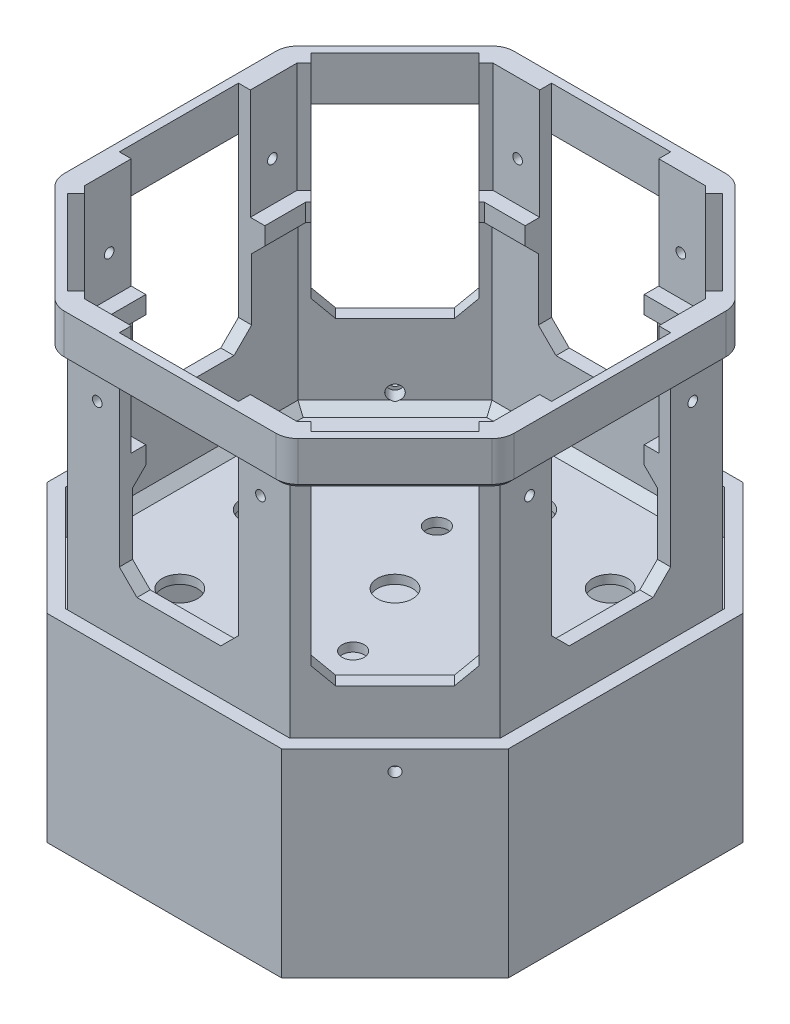
from build123d import *

# Parameters (mm, degrees)
EXTRUDE_1_DEPTH                      = 70
SKETCH_2_W                           = 27
SKETCH_2_H                           = 3
CUT_EXTRUDE_1_DEPTH                  = 50
CHAMFER_4_SIZE                       = 4
PATTERN_CIRCULAR_1_COUNT             = 4
CHAMFER_4_OF_PATTERN_CIRCULAR_1_SIZE = 4
EXTRUDE_2_DEPTH                      = 2
CHAMFER_2_SIZE                       = 2
EXTRUDE_3_DEPTH                      = 10
FILLET_1_R                           = 5
CHAMFER_3_SIZE                       = 1
SKETCH_8_R                           = 4
CUT_EXTRUDE_3_DEPTH                  = 100.126182212
SKETCH_9_R                           = 2.5
CUT_EXTRUDE_4_DEPTH                  = 100.126182212
EXTRUDE_START                        = -25
EXTRUDE_5_DEPTH                      = 4
PATTERN_CIRCULAR_16_COUNT            = 4
CHAMFER_6_SIZE                       = 3
EXTRUDE_6_DEPTH                      = 10
EXTRUDE_8_DEPTH                      = 3
EXTRUDE_9_DEPTH                      = 30
EXTRUDE_10_DEPTH                     = 2
FILLET_2_R                           = 8
CHAMFER_8_SIZE                       = 7
SKETCH_16_W                          = 10
SKETCH_16_H                          = 20
CUT_EXTRUDE_5_DEPTH                  = 30
CHAMFER_7_SIZE                       = 3
SKETCH_17_R                          = 1.65
CUT_EXTRUDE_6_DEPTH                  = 30
SKETCH_18_R                          = 1.15
CUT_EXTRUDE_7_DEPTH                  = 3
PATTERN_CIRCULAR_17_COUNT            = 4
PATTERN_CIRCULAR_18_COUNT            = 4
SKETCH_21_R                          = 1.1
CUT_EXTRUDE_8_DEPTH                  = 6
PATTERN_CIRCULAR_19_COUNT            = 4
CUT_EXTRUDE_9_REACH                  = 130.435


with BuildPart() as part:
    # 草图1 → 凸台-拉伸1 (new body)
    with BuildSketch(Plane(origin=(0, 0, 0), x_dir=(1, 0, 0), z_dir=(0, 1, 0))):
        Polygon((-25.246212025, -49), (25.246212025, -49), (49, -25.246212025), (49, 25.246212025), (25.246212025, 49), (-25.246212025, 49), (-49, 25.246212025), (-49, -25.246212025), align=None)
        Polygon((24.003571337, 46), (-24.003571337, 46), (-46, 24.003571337), (-46, -24.003571337), (-24.003571337, -46), (24.003571337, -46), (46, -24.003571337), (46, 24.003571337), align=None, mode=Mode.SUBTRACT)
    extrude(amount=EXTRUDE_1_DEPTH)

    # 草图2 → 切除-拉伸1 (cut)
    with BuildSketch(Plane(origin=(0, 70, 0), x_dir=(1, 0, 0), z_dir=(0, 1, 0))):
        with Locations((0, -47.5)):
            Rectangle(SKETCH_2_W, SKETCH_2_H)
        Polygon((27.577164466, -46.669047558), (25.455844123, -44.547727215), (44.547727215, -25.455844123), (46.669047558, -27.577164466), align=None)
    cut_extrude_1 = extrude(amount=-CUT_EXTRUDE_1_DEPTH, mode=Mode.SUBTRACT)

    # 倒角4
    chamfer_4_edges = [part.edges().sort_by_distance(p)[0] for p in [
        (13.5, 20, 47.5),
        (-13.5, 20, 47.5),
        (26.516504294, 20, 45.608387387),
        (45.608387387, 20, 26.516504294),
    ]]
    chamfer(chamfer_4_edges, length=CHAMFER_4_SIZE)

    # 阵列(圆周)1: 切除-拉伸1 ×4 about axis
    pattern_circular_1_axis = Axis((0, 0, 0), (0, 1, 0))
    for i in range(1, PATTERN_CIRCULAR_1_COUNT):
        add(cut_extrude_1.rotate(pattern_circular_1_axis, i * 360 / PATTERN_CIRCULAR_1_COUNT), mode=Mode.SUBTRACT)

    # 倒角4 of 阵列(圆周)1
    chamfer_4_of_pattern_circular_1_edges = [part.edges().sort_by_distance(p)[0] for p in [
        (47.5, 20, -13.5),
        (47.5, 20, 13.5),
        (45.608387387, 20, -26.516504294),
        (26.516504294, 20, -45.608387387),
        (-13.5, 20, -47.5),
        (13.5, 20, -47.5),
        (-26.516504294, 20, -45.608387387),
        (-45.608387387, 20, -26.516504294),
        (-47.5, 20, 13.5),
        (-47.5, 20, -13.5),
        (-45.608387387, 20, 26.516504294),
        (-26.516504294, 20, 45.608387387),
    ]]
    chamfer(chamfer_4_of_pattern_circular_1_edges, length=CHAMFER_4_OF_PATTERN_CIRCULAR_1_SIZE)

    # 草图6 → 凸台-拉伸2 (add)
    with BuildSketch(Plane.XZ):
        Polygon((-25.246212025, 49), (-49, 25.246212025), (-49, -25.246212025), (-25.246212025, -49), (25.246212025, -49), (49, -25.246212025), (49, 25.246212025), (25.246212025, 49), align=None)
    extrude(amount=-EXTRUDE_2_DEPTH)

    # 倒角2
    chamfer_2_edges = [part.edges().sort_by_distance(p)[0] for p in [
        (46, 2, 0),
        (0, 2, -46),
        (35.001785669, 2, -35.001785669),
        (35.001785669, 2, 35.001785669),
        (0, 2, 46),
        (-35.001785669, 2, 35.001785669),
        (-46, 2, 0),
        (-35.001785669, 2, -35.001785669),
    ]]
    chamfer(chamfer_2_edges, length=CHAMFER_2_SIZE)

    # 草图7 → 凸台-拉伸3 (add)
    with BuildSketch(Plane(origin=(0, 70, 0), x_dir=(1, 0, 0), z_dir=(0, 1, 0))):
        Polygon((26.074639149, 51), (-26.074639149, 51), (-51, 26.074639149), (-51, -26.074639149), (-26.074639149, -51), (26.074639149, -51), (51, -26.074639149), (51, 26.074639149), align=None)
        Polygon((-49, -25.246212025), (-25.246212025, -49), (25.246212025, -49), (49, -25.246212025), (49, 25.246212025), (25.246212025, 49), (-25.246212025, 49), (-49, 25.246212025), align=None, mode=Mode.SUBTRACT)
    extrude(amount=-EXTRUDE_3_DEPTH)

    # 圆角1
    fillet_1_edges = [part.edges().sort_by_distance(p)[0] for p in [
        (26.074639149, 65, -51),
        (51, 65, -26.074639149),
        (51, 65, 26.074639149),
        (26.074639149, 65, 51),
        (-26.074639149, 65, 51),
        (-51, 65, 26.074639149),
        (-51, 65, -26.074639149),
        (-26.074639149, 65, -51),
    ]]
    fillet(fillet_1_edges, radius=FILLET_1_R)

    # 倒角3
    chamfer_3_edges = [part.edges().sort_by_distance(p)[0] for p in [
        (38.537319575, 60, -38.537319575),
        (0, 60, -51),
        (51, 60, 0),
        (38.537319575, 60, 38.537319575),
        (0, 60, 51),
        (-38.537319575, 60, 38.537319575),
        (-51, 60, 0),
        (-38.537319575, 60, -38.537319575),
        (50.619397663, 60, 25.916988499),
        (50.619397663, 60, -25.916988499),
        (25.916988499, 60, 50.619397663),
        (-25.916988499, 60, 50.619397663),
        (-50.619397663, 60, 25.916988499),
        (-50.619397663, 60, -25.916988499),
        (-25.916988499, 60, -50.619397663),
        (25.916988499, 60, -50.619397663),
    ]]
    chamfer(chamfer_3_edges, length=CHAMFER_3_SIZE)

    # 草图8 → 切除-拉伸3 (cut, through all)
    with BuildSketch(Plane(origin=(0, 2, 0), x_dir=(1, 0, 0), z_dir=(0, 1, 0))):
        with Locations(Location((0, -31, 0), (0, 0, 270))):
            Circle(SKETCH_8_R)
        with Locations(Location((24.395183951, -24.395183951, 0), (0, 0, 270))):
            Circle(SKETCH_8_R)
        with Locations(Location((0, 0, 0), (0, 0, 270))):
            Circle(SKETCH_8_R)
        with Locations(Location((-31, 0, 0), (0, 0, 270))):
            Circle(SKETCH_8_R)
        with Locations(Location((-24.395183951, -24.395183951, 0), (0, 0, 270))):
            Circle(SKETCH_8_R)
        with Locations(Location((0, 31, 0), (0, 0, 270))):
            Circle(SKETCH_8_R)
        with Locations(Location((-24.395183951, 24.395183951, 0), (0, 0, 270))):
            Circle(SKETCH_8_R)
        with Locations(Location((31, 0, 0), (0, 0, 270))):
            Circle(SKETCH_8_R)
        with Locations(Location((24.395183951, 24.395183951, 0), (0, 0, 270))):
            Circle(SKETCH_8_R)
    extrude(amount=-CUT_EXTRUDE_3_DEPTH, mode=Mode.SUBTRACT)

    # 草图9 → 切除-拉伸4 (cut, through all)
    with BuildSketch(Plane(origin=(0, 2, 0), x_dir=(1, 0, 0), z_dir=(0, 1, 0))):
        with Locations(Location((7.5, -17, 0), (0, 0, 270))):
            Circle(SKETCH_9_R)
        with Locations(Location((-17, -7.5, 0), (0, 0, 270))):
            Circle(SKETCH_9_R)
        with Locations(Location((-7.5, 17, 0), (0, 0, 270))):
            Circle(SKETCH_9_R)
        with Locations(Location((17, 7.5, 0), (0, 0, 270))):
            Circle(SKETCH_9_R)
    extrude(amount=-CUT_EXTRUDE_4_DEPTH, mode=Mode.SUBTRACT)

    # 草图11 → 凸台-拉伸5 (add)
    with BuildSketch(Plane(origin=(0, 70, 0), x_dir=(1, 0, 0), z_dir=(0, 1, 0)).offset(EXTRUDE_START)):
        Polygon((24.003571337, -46), (25.455844123, -44.547727215), (23.334523779, -42.426406871), (22.76093065, -43), (13.5, -43), (13.5, -46), align=None)
        Polygon((-25.455844123, -44.547727215), (-24.003571337, -46), (-13.5, -46), (-13.5, -43), (-22.76093065, -43), (-23.334523779, -42.426406871), align=None)
    extrude_5 = extrude(amount=-EXTRUDE_5_DEPTH)

    # 阵列(圆周)16: 凸台-拉伸5 ×4 about axis
    pattern_circular_16_axis = Axis((0, 0, 0), (0, 1, 0))
    for i in range(1, PATTERN_CIRCULAR_16_COUNT):
        add(extrude_5.rotate(pattern_circular_16_axis, i * 360 / PATTERN_CIRCULAR_16_COUNT))

    # 倒角6
    chamfer_6_edges = [part.edges().sort_by_distance(p)[0] for p in [
        (18.751785669, 41, 46),
        (-18.751785669, 41, 46),
        (46, 41, -18.751785669),
        (46, 41, 18.751785669),
        (-18.751785669, 41, -46),
        (18.751785669, 41, -46),
        (-46, 41, 18.751785669),
        (-46, 41, -18.751785669),
    ]]
    chamfer(chamfer_6_edges, length=CHAMFER_6_SIZE)

    # 草图17 → 切除-拉伸6 (cut)
    with BuildSketch(Plane(origin=(-37.123106012, 0, -37.123106012), x_dir=(-0.7071067811865475, 0, 0.7071067811865477), z_dir=(-0.7071067811865477, 0, -0.7071067811865475))):
        with Locations((0, 5.5)):
            Circle(SKETCH_17_R)
    cut_extrude_6 = extrude(amount=-CUT_EXTRUDE_6_DEPTH, mode=Mode.SUBTRACT)

    # 阵列(圆周)17: 切除-拉伸6 ×4 about axis
    pattern_circular_17_axis = Axis((0, -4, 0), (0, 1, 0))
    for i in range(1, PATTERN_CIRCULAR_17_COUNT):
        add(cut_extrude_6.rotate(pattern_circular_17_axis, i * 360 / PATTERN_CIRCULAR_17_COUNT), mode=Mode.SUBTRACT)

    # 草图21 → 切除-拉伸8 (cut)
    with BuildSketch(Plane.ZY.offset(49)):
        with Locations((-18.501785669, 54)):
            Circle(SKETCH_21_R)
        with Locations((18.501785669, 54)):
            Circle(SKETCH_21_R)
    cut_extrude_8 = extrude(amount=-CUT_EXTRUDE_8_DEPTH, mode=Mode.SUBTRACT)

    # 阵列(圆周)19: 切除-拉伸8 ×4 about axis
    pattern_circular_19_axis = Axis((0, -4, 0), (0, 1, 0))
    for i in range(1, PATTERN_CIRCULAR_19_COUNT):
        add(cut_extrude_8.rotate(pattern_circular_19_axis, i * 360 / PATTERN_CIRCULAR_19_COUNT), mode=Mode.SUBTRACT)

    # 切除-拉伸9: up to this face of the body (flat: up to its plane)
    cut_extrude_9_end = Plane(part.part.faces().sort_by_distance((-19.151897375, 45, -44.486770389))[0])
    # 草图22 → 切除-拉伸9 (cut, up to the picked face)
    with BuildSketch(Plane(origin=(0, 70, 0), x_dir=(1, 0, 0), z_dir=(0, 1, 0)), mode=Mode.PRIVATE) as cut_extrude_9_sk1:
        Polygon((24.127835406, 46.3), (46.3, 24.127835406), (46.3, -24.127835406), (24.127835406, -46.3), (-24.127835406, -46.3), (-46.3, -24.127835406), (-46.3, 24.127835406), (-24.127835406, 46.3), align=None)
        Polygon((24.003571337, 46), (46, 24.003571337), (46, -24.003571337), (24.003571337, -46), (-24.003571337, -46), (-46, -24.003571337), (-46, 24.003571337), (-24.003571337, 46), align=None, mode=Mode.SUBTRACT)
    cut_extrude_9_tool1 = split(extrude(cut_extrude_9_sk1.sketch, amount=-CUT_EXTRUDE_9_REACH, mode=Mode.PRIVATE), bisect_by=cut_extrude_9_end, keep=Keep.BOTH, mode=Mode.PRIVATE)
    add(cut_extrude_9_tool1.solids().sort_by(Axis((35.121318, 70, -35.121318), (0, -1, 0)))[0], mode=Mode.SUBTRACT)


with BuildPart() as body_2:
    # 草图12 → 凸台-拉伸6 (new body)
    with BuildSketch(Plane.XZ):
        Polygon((26.61311678, 52.3), (-26.61311678, 52.3), (-52.3, 26.61311678), (-52.3, -26.61311678), (-26.61311678, -52.3), (26.61311678, -52.3), (52.3, -26.61311678), (52.3, 26.61311678), align=None)
        Polygon((-25.370476093, 49.3), (-49.3, 25.370476093), (-49.3, -25.370476093), (-25.370476093, -49.3), (25.370476093, -49.3), (49.3, -25.370476093), (49.3, 25.370476093), (25.370476093, 49.3), align=None, mode=Mode.SUBTRACT)
    extrude(amount=-EXTRUDE_6_DEPTH)

    # 草图13 → 凸台-拉伸8 (add)
    with BuildSketch(Plane.XZ):
        Polygon((52.3, 26.61311678), (26.61311678, 52.3), (-26.61311678, 52.3), (-52.3, 26.61311678), (-52.3, -26.61311678), (-26.61311678, -52.3), (26.61311678, -52.3), (52.3, -26.61311678), align=None)
        Polygon((-42.3, 22.470981157), (-42.3, -22.470981157), (-22.470981157, -42.3), (22.470981157, -42.3), (42.3, -22.470981157), (42.3, 22.470981157), (22.470981157, 42.3), (-22.470981157, 42.3), align=None, mode=Mode.SUBTRACT)
    extrude(amount=EXTRUDE_8_DEPTH)

    # 草图14 → 凸台-拉伸9 (add)
    with BuildSketch(Plane.XZ.offset(3)):
        Polygon((52.3, -26.61311678), (52.3, 26.61311678), (26.61311678, 52.3), (-26.61311678, 52.3), (-52.3, 26.61311678), (-52.3, -26.61311678), (-26.61311678, -52.3), (26.61311678, -52.3), align=None)
        Polygon((-49.3, 25.370476093), (-49.3, -25.370476093), (-25.370476093, -49.3), (25.370476093, -49.3), (49.3, -25.370476093), (49.3, 25.370476093), (25.370476093, 49.3), (-25.370476093, 49.3), align=None, mode=Mode.SUBTRACT)
    extrude(amount=EXTRUDE_9_DEPTH)

    # 草图15 → 凸台-拉伸10 (add)
    with BuildSketch(Plane.XZ.offset(33)):
        Polygon((26.61311678, -52.3), (52.3, -26.61311678), (52.3, 26.61311678), (26.61311678, 52.3), (-26.61311678, 52.3), (-52.3, 26.61311678), (-52.3, -26.61311678), (-26.61311678, -52.3), align=None)
    extrude(amount=EXTRUDE_10_DEPTH)

    # 圆角2
    fillet_2_edges = [body_2.edges().sort_by_distance(p)[0] for p in [
        (-49.3, -18, 25.370476093),
        (-49.3, -18, -25.370476093),
        (-25.370476093, -18, -49.3),
        (25.370476093, -18, -49.3),
        (49.3, -18, -25.370476093),
        (49.3, -18, 25.370476093),
        (25.370476093, -18, 49.3),
        (-25.370476093, -18, 49.3),
    ]]
    fillet(fillet_2_edges, radius=FILLET_2_R)

    # 倒角8
    # the kernel refuses this chamfer: 7 mm, written as the material it adds along each edge
    with BuildSketch(Plane(origin=(-27.713621844, -3, 46.956854249), x_dir=(0.7068394360706735, 0.027495876610586365, -0.7068394360706735), z_dir=(-0.7071067811865476, 0, -0.7071067811865476))) as chamfer_8_piece_1_section:
        Polygon((CHAMFER_8_SIZE * 0.999621916911, CHAMFER_8_SIZE * 0.0274958766106), (-CHAMFER_8_SIZE * 0.0274958766106, CHAMFER_8_SIZE * 0.999621916911), (0, 0), align=None)
    chamfer_8_piece_1 = extrude(amount=27.214040252, mode=Mode.PRIVATE)
    chamfer_8_piece_1 = split(chamfer_8_piece_1, bisect_by=Plane(origin=(-32.385490578, -5.31282908, 32.385490578), z_dir=(-0.7071067811865477, 0, 0.7071067811865474)), keep=Keep.TOP, mode=Mode.PRIVATE)
    add(chamfer_8_piece_1)
    with BuildSketch(Plane(origin=(-49.3, -3, 22.056767594), x_dir=(0.9996219169112968, 0.027495876610586372, 0), z_dir=(0, 0, -1))) as chamfer_8_piece_2_section:
        Polygon((CHAMFER_8_SIZE * 0.999621916911, CHAMFER_8_SIZE * 0.0274958766106), (-CHAMFER_8_SIZE * 0.0274958766106, CHAMFER_8_SIZE * 0.999621916911), (0, 0), align=None)
    chamfer_8_piece_2 = extrude(amount=44.113535189, mode=Mode.PRIVATE)
    chamfer_8_piece_2 = split(chamfer_8_piece_2, bisect_by=Plane(origin=(-42.3, -5.31282908, 0), z_dir=(-1, 0, 0)), keep=Keep.TOP, mode=Mode.PRIVATE)
    add(chamfer_8_piece_2)
    with BuildSketch(Plane(origin=(-46.956854249, -3, -27.713621844), x_dir=(0.7068394360706735, 0.027495876610586365, 0.7068394360706735), z_dir=(0.7071067811865476, 0, -0.7071067811865476))) as chamfer_8_piece_3_section:
        Polygon((CHAMFER_8_SIZE * 0.999621916911, CHAMFER_8_SIZE * 0.0274958766106), (-CHAMFER_8_SIZE * 0.0274958766106, CHAMFER_8_SIZE * 0.999621916911), (0, 0), align=None)
    chamfer_8_piece_3 = extrude(amount=27.214040252, mode=Mode.PRIVATE)
    chamfer_8_piece_3 = split(chamfer_8_piece_3, bisect_by=Plane(origin=(-32.385490578, -5.31282908, -32.385490578), z_dir=(-0.7071067811865477, 0, -0.7071067811865474)), keep=Keep.TOP, mode=Mode.PRIVATE)
    add(chamfer_8_piece_3)
    with BuildSketch(Plane(origin=(-22.056767594, -3, -49.3), x_dir=(0, 0.027495876610586372, 0.9996219169112968), z_dir=(1, 0, 0))) as chamfer_8_piece_4_section:
        Polygon((CHAMFER_8_SIZE * 0.999621916911, CHAMFER_8_SIZE * 0.0274958766106), (-CHAMFER_8_SIZE * 0.0274958766106, CHAMFER_8_SIZE * 0.999621916911), (0, 0), align=None)
    chamfer_8_piece_4 = extrude(amount=44.113535189, mode=Mode.PRIVATE)
    chamfer_8_piece_4 = split(chamfer_8_piece_4, bisect_by=Plane(origin=(0, -5.31282908, -42.3), z_dir=(0, 0, -1)), keep=Keep.TOP, mode=Mode.PRIVATE)
    add(chamfer_8_piece_4)
    with BuildSketch(Plane(origin=(27.713621844, -3, -46.956854249), x_dir=(-0.7068394360706737, 0.02749587661058637, 0.7068394360706735), z_dir=(0.7071067811865475, 0, 0.7071067811865477))) as chamfer_8_piece_5_section:
        Polygon((CHAMFER_8_SIZE * 0.999621916911, CHAMFER_8_SIZE * 0.0274958766106), (-CHAMFER_8_SIZE * 0.0274958766106, CHAMFER_8_SIZE * 0.999621916911), (0, 0), align=None)
    chamfer_8_piece_5 = extrude(amount=27.214040252, mode=Mode.PRIVATE)
    chamfer_8_piece_5 = split(chamfer_8_piece_5, bisect_by=Plane(origin=(32.385490578, -5.31282908, -32.385490578), z_dir=(0.7071067811865477, 0, -0.7071067811865474)), keep=Keep.TOP, mode=Mode.PRIVATE)
    add(chamfer_8_piece_5)
    with BuildSketch(Plane(origin=(49.3, -3, -22.056767594), x_dir=(-0.9996219169112968, 0.027495876610586372, 0), z_dir=(0, 0, 1))) as chamfer_8_piece_6_section:
        Polygon((CHAMFER_8_SIZE * 0.999621916911, CHAMFER_8_SIZE * 0.0274958766106), (-CHAMFER_8_SIZE * 0.0274958766106, CHAMFER_8_SIZE * 0.999621916911), (0, 0), align=None)
    chamfer_8_piece_6 = extrude(amount=44.113535189, mode=Mode.PRIVATE)
    chamfer_8_piece_6 = split(chamfer_8_piece_6, bisect_by=Plane(origin=(42.3, -5.31282908, 0), z_dir=(1, 0, 0)), keep=Keep.TOP, mode=Mode.PRIVATE)
    add(chamfer_8_piece_6)
    with BuildSketch(Plane(origin=(46.956854249, -3, 27.713621844), x_dir=(-0.7068394360706735, 0.027495876610586365, -0.7068394360706735), z_dir=(-0.7071067811865476, 0, 0.7071067811865476))) as chamfer_8_piece_7_section:
        Polygon((CHAMFER_8_SIZE * 0.999621916911, CHAMFER_8_SIZE * 0.0274958766106), (-CHAMFER_8_SIZE * 0.0274958766106, CHAMFER_8_SIZE * 0.999621916911), (0, 0), align=None)
    chamfer_8_piece_7 = extrude(amount=27.214040252, mode=Mode.PRIVATE)
    chamfer_8_piece_7 = split(chamfer_8_piece_7, bisect_by=Plane(origin=(32.385490578, -5.31282908, 32.385490578), z_dir=(0.7071067811865476, 0, 0.7071067811865475)), keep=Keep.TOP, mode=Mode.PRIVATE)
    add(chamfer_8_piece_7)
    with BuildSketch(Plane(origin=(22.056767594, -3, 49.3), x_dir=(0, 0.027495876610586372, -0.9996219169112968), z_dir=(-1, 0, 0))) as chamfer_8_piece_8_section:
        Polygon((CHAMFER_8_SIZE * 0.999621916911, CHAMFER_8_SIZE * 0.0274958766106), (-CHAMFER_8_SIZE * 0.0274958766106, CHAMFER_8_SIZE * 0.999621916911), (0, 0), align=None)
    chamfer_8_piece_8 = extrude(amount=44.113535189, mode=Mode.PRIVATE)
    chamfer_8_piece_8 = split(chamfer_8_piece_8, bisect_by=Plane(origin=(0, -5.31282908, 42.3), z_dir=(0, 0, 1)), keep=Keep.TOP, mode=Mode.PRIVATE)
    add(chamfer_8_piece_8)
    with BuildSketch(Plane(origin=(-41.3, -3, -22.056767594), x_dir=(-1, 0, 0), z_dir=(0, 0, 1))) as chamfer_8_piece_9_section:
        Polygon((8 - CHAMFER_8_SIZE, 0), (8, CHAMFER_8_SIZE), (8, 0), align=None)
    chamfer_8_piece_9 = revolve(axis=Axis((-41.3, -3, -22.056767594), (0, -1, 0)), revolution_arc=45, mode=Mode.PRIVATE)
    chamfer_8_piece_9 = split(chamfer_8_piece_9, bisect_by=Plane(origin=(-42.3, -2.929379704, -22.188241273), z_dir=(-1, 0, 0)), keep=Keep.TOP, mode=Mode.PRIVATE)
    chamfer_8_piece_9 = split(chamfer_8_piece_9, bisect_by=Plane(origin=(-42.519175486, -2.929379704, -22.251805671), z_dir=(0.7071067811865477, 0, 0.7071067811865474)), keep=Keep.TOP, mode=Mode.PRIVATE)
    add(chamfer_8_piece_9)
    with BuildSketch(Plane(origin=(-41.3, -3, -22.056767594), x_dir=(-1, 0, 0), z_dir=(0, 0, 1))) as chamfer_8_piece_10_section:
        Polygon((8 - CHAMFER_8_SIZE, 0), (8, CHAMFER_8_SIZE), (8, 0), align=None)
    chamfer_8_piece_10 = revolve(axis=Axis((-41.3, -3, -22.056767594), (0, -1, 0)), revolution_arc=45, mode=Mode.PRIVATE)
    chamfer_8_piece_10 = split(chamfer_8_piece_10, bisect_by=Plane(origin=(-42.3, -2.929379703, -22.7809421), z_dir=(1, 0, 0)), keep=Keep.TOP, mode=Mode.PRIVATE)
    chamfer_8_piece_10 = split(chamfer_8_piece_10, bisect_by=Plane(origin=(-42.100072712, -2.929379703, -22.670908445), z_dir=(-0.7071067811865477, 0, -0.7071067811865474)), keep=Keep.TOP, mode=Mode.PRIVATE)
    add(chamfer_8_piece_10)
    with BuildSketch(Plane(origin=(-41.3, -3, -22.056767594), x_dir=(-1, 0, 0), z_dir=(0, 0, 1))) as chamfer_8_piece_11_section:
        Polygon((8 - CHAMFER_8_SIZE, 0), (8, CHAMFER_8_SIZE), (8, 0), align=None)
    chamfer_8_piece_11 = revolve(axis=Axis((-41.3, -3, -22.056767594), (0, -1, 0)), revolution_arc=45, mode=Mode.PRIVATE)
    chamfer_8_piece_11 = split(chamfer_8_piece_11, bisect_by=Plane(origin=(-42.3, -5.603524378, -24.385032101), z_dir=(-1, 0, 0)), keep=Keep.TOP, mode=Mode.PRIVATE)
    chamfer_8_piece_11 = split(chamfer_8_piece_11, bisect_by=Plane(origin=(-43.653438402, -5.603524378, -21.117542755), z_dir=(-0.7071067811865477, 0, -0.7071067811865474)), keep=Keep.TOP, mode=Mode.PRIVATE)
    add(chamfer_8_piece_11)
    with BuildSketch(Plane(origin=(-22.056767594, -3, -41.3), x_dir=(-0.7071067811865471, 0, -0.707106781186548), z_dir=(-0.707106781186548, 0, 0.7071067811865471))) as chamfer_8_piece_12_section:
        Polygon((8 - CHAMFER_8_SIZE, 0), (8, CHAMFER_8_SIZE), (8, 0), align=None)
    chamfer_8_piece_12 = revolve(axis=Axis((-22.056767594, -3, -41.3), (0, -1, 0)), revolution_arc=45, mode=Mode.PRIVATE)
    chamfer_8_piece_12 = split(chamfer_8_piece_12, bisect_by=Plane(origin=(-22.670908446, -2.929379704, -42.100072711), z_dir=(-0.7071067811865477, 0, -0.7071067811865474)), keep=Keep.TOP, mode=Mode.PRIVATE)
    chamfer_8_piece_12 = split(chamfer_8_piece_12, bisect_by=Plane(origin=(-22.780942101, -2.929379704, -42.3), z_dir=(0, 0, 1)), keep=Keep.TOP, mode=Mode.PRIVATE)
    add(chamfer_8_piece_12)
    with BuildSketch(Plane(origin=(-22.056767594, -3, -41.3), x_dir=(-0.7071067811865471, 0, -0.707106781186548), z_dir=(-0.707106781186548, 0, 0.7071067811865471))) as chamfer_8_piece_13_section:
        Polygon((8 - CHAMFER_8_SIZE, 0), (8, CHAMFER_8_SIZE), (8, 0), align=None)
    chamfer_8_piece_13 = revolve(axis=Axis((-22.056767594, -3, -41.3), (0, -1, 0)), revolution_arc=45, mode=Mode.PRIVATE)
    chamfer_8_piece_13 = split(chamfer_8_piece_13, bisect_by=Plane(origin=(-22.251805672, -2.929379703, -42.519175485), z_dir=(0.7071067811865477, 0, 0.7071067811865474)), keep=Keep.TOP, mode=Mode.PRIVATE)
    chamfer_8_piece_13 = split(chamfer_8_piece_13, bisect_by=Plane(origin=(-22.188241275, -2.929379703, -42.3), z_dir=(0, 0, -1)), keep=Keep.TOP, mode=Mode.PRIVATE)
    add(chamfer_8_piece_13)
    with BuildSketch(Plane(origin=(-22.056767594, -3, -41.3), x_dir=(-0.7071067811865471, 0, -0.707106781186548), z_dir=(-0.707106781186548, 0, 0.7071067811865471))) as chamfer_8_piece_14_section:
        Polygon((8 - CHAMFER_8_SIZE, 0), (8, CHAMFER_8_SIZE), (8, 0), align=None)
    chamfer_8_piece_14 = revolve(axis=Axis((-22.056767594, -3, -41.3), (0, -1, 0)), revolution_arc=45, mode=Mode.PRIVATE)
    chamfer_8_piece_14 = split(chamfer_8_piece_14, bisect_by=Plane(origin=(-21.117542755, -5.603524378, -43.653438402), z_dir=(-0.7071067811865477, 0, -0.7071067811865474)), keep=Keep.TOP, mode=Mode.PRIVATE)
    chamfer_8_piece_14 = split(chamfer_8_piece_14, bisect_by=Plane(origin=(-24.385032101, -5.603524378, -42.3), z_dir=(0, 0, -1)), keep=Keep.TOP, mode=Mode.PRIVATE)
    add(chamfer_8_piece_14)
    with BuildSketch(Plane(origin=(22.056767594, -3, -41.3), x_dir=(0, 0, -1), z_dir=(-1, 0, 0))) as chamfer_8_piece_15_section:
        Polygon((8 - CHAMFER_8_SIZE, 0), (8, CHAMFER_8_SIZE), (8, 0), align=None)
    chamfer_8_piece_15 = revolve(axis=Axis((22.056767594, -3, -41.3), (0, -1, 0)), revolution_arc=45, mode=Mode.PRIVATE)
    chamfer_8_piece_15 = split(chamfer_8_piece_15, bisect_by=Plane(origin=(22.188241273, -2.929379704, -42.3), z_dir=(0, 0, -1)), keep=Keep.TOP, mode=Mode.PRIVATE)
    chamfer_8_piece_15 = split(chamfer_8_piece_15, bisect_by=Plane(origin=(22.251805671, -2.929379704, -42.519175486), z_dir=(-0.7071067811865477, 0, 0.7071067811865474)), keep=Keep.TOP, mode=Mode.PRIVATE)
    add(chamfer_8_piece_15)
    with BuildSketch(Plane(origin=(22.056767594, -3, -41.3), x_dir=(0, 0, -1), z_dir=(-1, 0, 0))) as chamfer_8_piece_16_section:
        Polygon((8 - CHAMFER_8_SIZE, 0), (8, CHAMFER_8_SIZE), (8, 0), align=None)
    chamfer_8_piece_16 = revolve(axis=Axis((22.056767594, -3, -41.3), (0, -1, 0)), revolution_arc=45, mode=Mode.PRIVATE)
    chamfer_8_piece_16 = split(chamfer_8_piece_16, bisect_by=Plane(origin=(22.7809421, -2.929379703, -42.3), z_dir=(0, 0, 1)), keep=Keep.TOP, mode=Mode.PRIVATE)
    chamfer_8_piece_16 = split(chamfer_8_piece_16, bisect_by=Plane(origin=(22.670908445, -2.929379703, -42.100072712), z_dir=(0.7071067811865477, 0, -0.7071067811865474)), keep=Keep.TOP, mode=Mode.PRIVATE)
    add(chamfer_8_piece_16)
    with BuildSketch(Plane(origin=(22.056767594, -3, -41.3), x_dir=(0, 0, -1), z_dir=(-1, 0, 0))) as chamfer_8_piece_17_section:
        Polygon((8 - CHAMFER_8_SIZE, 0), (8, CHAMFER_8_SIZE), (8, 0), align=None)
    chamfer_8_piece_17 = revolve(axis=Axis((22.056767594, -3, -41.3), (0, -1, 0)), revolution_arc=45, mode=Mode.PRIVATE)
    chamfer_8_piece_17 = split(chamfer_8_piece_17, bisect_by=Plane(origin=(24.385032101, -5.603524378, -42.3), z_dir=(0, 0, -1)), keep=Keep.TOP, mode=Mode.PRIVATE)
    chamfer_8_piece_17 = split(chamfer_8_piece_17, bisect_by=Plane(origin=(21.117542755, -5.603524378, -43.653438402), z_dir=(0.7071067811865477, 0, -0.7071067811865474)), keep=Keep.TOP, mode=Mode.PRIVATE)
    add(chamfer_8_piece_17)
    with BuildSketch(Plane(origin=(41.3, -3, -22.056767594), x_dir=(0.7071067811865478, 0, -0.7071067811865474), z_dir=(-0.7071067811865474, 0, -0.7071067811865478))) as chamfer_8_piece_18_section:
        Polygon((8 - CHAMFER_8_SIZE, 0), (8, CHAMFER_8_SIZE), (8, 0), align=None)
    chamfer_8_piece_18 = revolve(axis=Axis((41.3, -3, -22.056767594), (0, -1, 0)), revolution_arc=45, mode=Mode.PRIVATE)
    chamfer_8_piece_18 = split(chamfer_8_piece_18, bisect_by=Plane(origin=(42.3, -2.929379704, -22.780942101), z_dir=(-1, 0, 0)), keep=Keep.TOP, mode=Mode.PRIVATE)
    chamfer_8_piece_18 = split(chamfer_8_piece_18, bisect_by=Plane(origin=(42.100072711, -2.929379704, -22.670908446), z_dir=(0.7071067811865477, 0, -0.7071067811865474)), keep=Keep.TOP, mode=Mode.PRIVATE)
    add(chamfer_8_piece_18)
    with BuildSketch(Plane(origin=(41.3, -3, -22.056767594), x_dir=(0.7071067811865478, 0, -0.7071067811865474), z_dir=(-0.7071067811865474, 0, -0.7071067811865478))) as chamfer_8_piece_19_section:
        Polygon((8 - CHAMFER_8_SIZE, 0), (8, CHAMFER_8_SIZE), (8, 0), align=None)
    chamfer_8_piece_19 = revolve(axis=Axis((41.3, -3, -22.056767594), (0, -1, 0)), revolution_arc=45, mode=Mode.PRIVATE)
    chamfer_8_piece_19 = split(chamfer_8_piece_19, bisect_by=Plane(origin=(42.3, -2.929379703, -22.188241275), z_dir=(1, 0, 0)), keep=Keep.TOP, mode=Mode.PRIVATE)
    chamfer_8_piece_19 = split(chamfer_8_piece_19, bisect_by=Plane(origin=(42.519175485, -2.929379703, -22.251805672), z_dir=(-0.7071067811865477, 0, 0.7071067811865474)), keep=Keep.TOP, mode=Mode.PRIVATE)
    add(chamfer_8_piece_19)
    with BuildSketch(Plane(origin=(41.3, -3, -22.056767594), x_dir=(0.7071067811865478, 0, -0.7071067811865474), z_dir=(-0.7071067811865474, 0, -0.7071067811865478))) as chamfer_8_piece_20_section:
        Polygon((8 - CHAMFER_8_SIZE, 0), (8, CHAMFER_8_SIZE), (8, 0), align=None)
    chamfer_8_piece_20 = revolve(axis=Axis((41.3, -3, -22.056767594), (0, -1, 0)), revolution_arc=45, mode=Mode.PRIVATE)
    chamfer_8_piece_20 = split(chamfer_8_piece_20, bisect_by=Plane(origin=(42.3, -5.603524378, -24.385032101), z_dir=(1, 0, 0)), keep=Keep.TOP, mode=Mode.PRIVATE)
    chamfer_8_piece_20 = split(chamfer_8_piece_20, bisect_by=Plane(origin=(43.653438402, -5.603524378, -21.117542755), z_dir=(0.7071067811865477, 0, -0.7071067811865474)), keep=Keep.TOP, mode=Mode.PRIVATE)
    add(chamfer_8_piece_20)
    with BuildSketch(Plane(origin=(41.3, -3, 22.056767594), x_dir=(1, 0, 0), z_dir=(0, 0, -1))) as chamfer_8_piece_21_section:
        Polygon((8 - CHAMFER_8_SIZE, 0), (8, CHAMFER_8_SIZE), (8, 0), align=None)
    chamfer_8_piece_21 = revolve(axis=Axis((41.3, -3, 22.056767594), (0, -1, 0)), revolution_arc=45, mode=Mode.PRIVATE)
    chamfer_8_piece_21 = split(chamfer_8_piece_21, bisect_by=Plane(origin=(42.519175486, -2.929379704, 22.251805671), z_dir=(-0.7071067811865476, 0, -0.7071067811865475)), keep=Keep.TOP, mode=Mode.PRIVATE)
    chamfer_8_piece_21 = split(chamfer_8_piece_21, bisect_by=Plane(origin=(42.3, -2.929379704, 22.188241273), z_dir=(1, 0, 0)), keep=Keep.TOP, mode=Mode.PRIVATE)
    add(chamfer_8_piece_21)
    with BuildSketch(Plane(origin=(41.3, -3, 22.056767594), x_dir=(1, 0, 0), z_dir=(0, 0, -1))) as chamfer_8_piece_22_section:
        Polygon((8 - CHAMFER_8_SIZE, 0), (8, CHAMFER_8_SIZE), (8, 0), align=None)
    chamfer_8_piece_22 = revolve(axis=Axis((41.3, -3, 22.056767594), (0, -1, 0)), revolution_arc=45, mode=Mode.PRIVATE)
    chamfer_8_piece_22 = split(chamfer_8_piece_22, bisect_by=Plane(origin=(42.100072712, -2.929379703, 22.670908445), z_dir=(0.7071067811865476, 0, 0.7071067811865475)), keep=Keep.TOP, mode=Mode.PRIVATE)
    chamfer_8_piece_22 = split(chamfer_8_piece_22, bisect_by=Plane(origin=(42.3, -2.929379703, 22.7809421), z_dir=(-1, 0, 0)), keep=Keep.TOP, mode=Mode.PRIVATE)
    add(chamfer_8_piece_22)
    with BuildSketch(Plane(origin=(41.3, -3, 22.056767594), x_dir=(1, 0, 0), z_dir=(0, 0, -1))) as chamfer_8_piece_23_section:
        Polygon((8 - CHAMFER_8_SIZE, 0), (8, CHAMFER_8_SIZE), (8, 0), align=None)
    chamfer_8_piece_23 = revolve(axis=Axis((41.3, -3, 22.056767594), (0, -1, 0)), revolution_arc=45, mode=Mode.PRIVATE)
    chamfer_8_piece_23 = split(chamfer_8_piece_23, bisect_by=Plane(origin=(43.653438402, -5.603524378, 21.117542755), z_dir=(0.7071067811865476, 0, 0.7071067811865475)), keep=Keep.TOP, mode=Mode.PRIVATE)
    chamfer_8_piece_23 = split(chamfer_8_piece_23, bisect_by=Plane(origin=(42.3, -5.603524378, 24.385032101), z_dir=(1, 0, 0)), keep=Keep.TOP, mode=Mode.PRIVATE)
    add(chamfer_8_piece_23)
    with BuildSketch(Plane(origin=(22.056767594, -3, 41.3), x_dir=(0.7071067811865474, 0, 0.7071067811865478), z_dir=(0.7071067811865478, 0, -0.7071067811865474))) as chamfer_8_piece_24_section:
        Polygon((8 - CHAMFER_8_SIZE, 0), (8, CHAMFER_8_SIZE), (8, 0), align=None)
    chamfer_8_piece_24 = revolve(axis=Axis((22.056767594, -3, 41.3), (0, -1, 0)), revolution_arc=45, mode=Mode.PRIVATE)
    chamfer_8_piece_24 = split(chamfer_8_piece_24, bisect_by=Plane(origin=(22.780942101, -2.929379704, 42.3), z_dir=(0, 0, -1)), keep=Keep.TOP, mode=Mode.PRIVATE)
    chamfer_8_piece_24 = split(chamfer_8_piece_24, bisect_by=Plane(origin=(22.670908446, -2.929379704, 42.100072711), z_dir=(0.7071067811865476, 0, 0.7071067811865475)), keep=Keep.TOP, mode=Mode.PRIVATE)
    add(chamfer_8_piece_24)
    with BuildSketch(Plane(origin=(22.056767594, -3, 41.3), x_dir=(0.7071067811865474, 0, 0.7071067811865478), z_dir=(0.7071067811865478, 0, -0.7071067811865474))) as chamfer_8_piece_25_section:
        Polygon((8 - CHAMFER_8_SIZE, 0), (8, CHAMFER_8_SIZE), (8, 0), align=None)
    chamfer_8_piece_25 = revolve(axis=Axis((22.056767594, -3, 41.3), (0, -1, 0)), revolution_arc=45, mode=Mode.PRIVATE)
    chamfer_8_piece_25 = split(chamfer_8_piece_25, bisect_by=Plane(origin=(22.188241275, -2.929379703, 42.3), z_dir=(0, 0, 1)), keep=Keep.TOP, mode=Mode.PRIVATE)
    chamfer_8_piece_25 = split(chamfer_8_piece_25, bisect_by=Plane(origin=(22.251805672, -2.929379703, 42.519175485), z_dir=(-0.7071067811865476, 0, -0.7071067811865475)), keep=Keep.TOP, mode=Mode.PRIVATE)
    add(chamfer_8_piece_25)
    with BuildSketch(Plane(origin=(22.056767594, -3, 41.3), x_dir=(0.7071067811865474, 0, 0.7071067811865478), z_dir=(0.7071067811865478, 0, -0.7071067811865474))) as chamfer_8_piece_26_section:
        Polygon((8 - CHAMFER_8_SIZE, 0), (8, CHAMFER_8_SIZE), (8, 0), align=None)
    chamfer_8_piece_26 = revolve(axis=Axis((22.056767594, -3, 41.3), (0, -1, 0)), revolution_arc=45, mode=Mode.PRIVATE)
    chamfer_8_piece_26 = split(chamfer_8_piece_26, bisect_by=Plane(origin=(24.385032101, -5.603524378, 42.3), z_dir=(0, 0, 1)), keep=Keep.TOP, mode=Mode.PRIVATE)
    chamfer_8_piece_26 = split(chamfer_8_piece_26, bisect_by=Plane(origin=(21.117542755, -5.603524378, 43.653438402), z_dir=(0.7071067811865476, 0, 0.7071067811865475)), keep=Keep.TOP, mode=Mode.PRIVATE)
    add(chamfer_8_piece_26)
    with BuildSketch(Plane(origin=(-22.056767594, -3, 41.3), x_dir=(-0.7071067811865471, 0, 0.707106781186548), z_dir=(-0.707106781186548, 0, -0.7071067811865471))) as chamfer_8_piece_27_section:
        Polygon((8 - CHAMFER_8_SIZE, 0), (8, -CHAMFER_8_SIZE), (8, 0), align=None)
    chamfer_8_piece_27 = revolve(axis=Axis((-22.056767594, -3, 41.3), (0, 1, 0)), revolution_arc=45, mode=Mode.PRIVATE)
    chamfer_8_piece_27 = split(chamfer_8_piece_27, bisect_by=Plane(origin=(-22.670908446, -2.929379704, 42.100072711), z_dir=(-0.7071067811865477, 0, 0.7071067811865474)), keep=Keep.TOP, mode=Mode.PRIVATE)
    chamfer_8_piece_27 = split(chamfer_8_piece_27, bisect_by=Plane(origin=(-22.780942101, -2.929379704, 42.3), z_dir=(0, 0, -1)), keep=Keep.TOP, mode=Mode.PRIVATE)
    add(chamfer_8_piece_27)
    with BuildSketch(Plane(origin=(-22.056767594, -3, 41.3), x_dir=(-0.7071067811865471, 0, 0.707106781186548), z_dir=(-0.707106781186548, 0, -0.7071067811865471))) as chamfer_8_piece_28_section:
        Polygon((8 - CHAMFER_8_SIZE, 0), (8, -CHAMFER_8_SIZE), (8, 0), align=None)
    chamfer_8_piece_28 = revolve(axis=Axis((-22.056767594, -3, 41.3), (0, 1, 0)), revolution_arc=45, mode=Mode.PRIVATE)
    chamfer_8_piece_28 = split(chamfer_8_piece_28, bisect_by=Plane(origin=(-22.251805672, -2.929379703, 42.519175485), z_dir=(0.7071067811865477, 0, -0.7071067811865474)), keep=Keep.TOP, mode=Mode.PRIVATE)
    chamfer_8_piece_28 = split(chamfer_8_piece_28, bisect_by=Plane(origin=(-22.188241275, -2.929379703, 42.3), z_dir=(0, 0, 1)), keep=Keep.TOP, mode=Mode.PRIVATE)
    add(chamfer_8_piece_28)
    with BuildSketch(Plane(origin=(-22.056767594, -3, 41.3), x_dir=(-0.7071067811865471, 0, 0.707106781186548), z_dir=(-0.707106781186548, 0, -0.7071067811865471))) as chamfer_8_piece_29_section:
        Polygon((8 - CHAMFER_8_SIZE, 0), (8, -CHAMFER_8_SIZE), (8, 0), align=None)
    chamfer_8_piece_29 = revolve(axis=Axis((-22.056767594, -3, 41.3), (0, 1, 0)), revolution_arc=45, mode=Mode.PRIVATE)
    chamfer_8_piece_29 = split(chamfer_8_piece_29, bisect_by=Plane(origin=(-21.117542755, -5.603524378, 43.653438402), z_dir=(-0.7071067811865477, 0, 0.7071067811865474)), keep=Keep.TOP, mode=Mode.PRIVATE)
    chamfer_8_piece_29 = split(chamfer_8_piece_29, bisect_by=Plane(origin=(-24.385032101, -5.603524378, 42.3), z_dir=(0, 0, 1)), keep=Keep.TOP, mode=Mode.PRIVATE)
    add(chamfer_8_piece_29)
    with BuildSketch(Plane(origin=(-41.3, -3, 22.056767594), x_dir=(-0.7071067811865478, 0, 0.7071067811865474), z_dir=(0.7071067811865474, 0, 0.7071067811865478))) as chamfer_8_piece_30_section:
        Polygon((8 - CHAMFER_8_SIZE, 0), (8, CHAMFER_8_SIZE), (8, 0), align=None)
    chamfer_8_piece_30 = revolve(axis=Axis((-41.3, -3, 22.056767594), (0, -1, 0)), revolution_arc=45, mode=Mode.PRIVATE)
    chamfer_8_piece_30 = split(chamfer_8_piece_30, bisect_by=Plane(origin=(-42.100072711, -2.929379704, 22.670908446), z_dir=(-0.7071067811865477, 0, 0.7071067811865474)), keep=Keep.TOP, mode=Mode.PRIVATE)
    chamfer_8_piece_30 = split(chamfer_8_piece_30, bisect_by=Plane(origin=(-42.3, -2.929379704, 22.780942101), z_dir=(1, 0, 0)), keep=Keep.TOP, mode=Mode.PRIVATE)
    add(chamfer_8_piece_30)
    with BuildSketch(Plane(origin=(-41.3, -3, 22.056767594), x_dir=(-0.7071067811865478, 0, 0.7071067811865474), z_dir=(0.7071067811865474, 0, 0.7071067811865478))) as chamfer_8_piece_31_section:
        Polygon((8 - CHAMFER_8_SIZE, 0), (8, CHAMFER_8_SIZE), (8, 0), align=None)
    chamfer_8_piece_31 = revolve(axis=Axis((-41.3, -3, 22.056767594), (0, -1, 0)), revolution_arc=45, mode=Mode.PRIVATE)
    chamfer_8_piece_31 = split(chamfer_8_piece_31, bisect_by=Plane(origin=(-42.519175485, -2.929379703, 22.251805672), z_dir=(0.7071067811865477, 0, -0.7071067811865474)), keep=Keep.TOP, mode=Mode.PRIVATE)
    chamfer_8_piece_31 = split(chamfer_8_piece_31, bisect_by=Plane(origin=(-42.3, -2.929379703, 22.188241275), z_dir=(-1, 0, 0)), keep=Keep.TOP, mode=Mode.PRIVATE)
    add(chamfer_8_piece_31)
    with BuildSketch(Plane(origin=(-41.3, -3, 22.056767594), x_dir=(-0.7071067811865478, 0, 0.7071067811865474), z_dir=(0.7071067811865474, 0, 0.7071067811865478))) as chamfer_8_piece_32_section:
        Polygon((8 - CHAMFER_8_SIZE, 0), (8, CHAMFER_8_SIZE), (8, 0), align=None)
    chamfer_8_piece_32 = revolve(axis=Axis((-41.3, -3, 22.056767594), (0, -1, 0)), revolution_arc=45, mode=Mode.PRIVATE)
    chamfer_8_piece_32 = split(chamfer_8_piece_32, bisect_by=Plane(origin=(-43.653438402, -5.603524378, 21.117542755), z_dir=(-0.7071067811865477, 0, 0.7071067811865474)), keep=Keep.TOP, mode=Mode.PRIVATE)
    chamfer_8_piece_32 = split(chamfer_8_piece_32, bisect_by=Plane(origin=(-42.3, -5.603524378, 24.385032101), z_dir=(-1, 0, 0)), keep=Keep.TOP, mode=Mode.PRIVATE)
    add(chamfer_8_piece_32)

    # 草图16 → 切除-拉伸5 (cut)
    with BuildSketch(Plane(origin=(0, 10, 0), x_dir=(1, 0, 0), z_dir=(0, 1, 0))):
        with Locations((-47.3, 0)):
            Rectangle(SKETCH_16_W, SKETCH_16_H)
    extrude(amount=-CUT_EXTRUDE_5_DEPTH, mode=Mode.SUBTRACT)

    # 倒角7
    chamfer_7_edges = [body_2.edges().sort_by_distance(p)[0] for p in [
        (-50.8, 10, 10),
        (-50.8, 10, -10),
        (-50.8, -20, 10),
        (-50.8, -20, -10),
    ]]
    chamfer(chamfer_7_edges, length=CHAMFER_7_SIZE)

    # 草图18 → 切除-拉伸7 (cut)
    with BuildSketch(Plane(origin=(-39.45655839, 0, -39.45655839), x_dir=(-0.7071067811865475, 0, 0.7071067811865476), z_dir=(-0.7071067811865476, 0, -0.7071067811865475))):
        with Locations((0, 5.5)):
            Circle(SKETCH_18_R)
    cut_extrude_7 = extrude(amount=-CUT_EXTRUDE_7_DEPTH, mode=Mode.SUBTRACT)

    # 阵列(圆周)18: 切除-拉伸7 ×4 about axis
    pattern_circular_18_axis = Axis((0, -4, 0), (0, 1, 0))
    for i in range(1, PATTERN_CIRCULAR_18_COUNT):
        add(cut_extrude_7.rotate(pattern_circular_18_axis, i * 360 / PATTERN_CIRCULAR_18_COUNT), mode=Mode.SUBTRACT)


solid = Compound([part.part, body_2.part])
